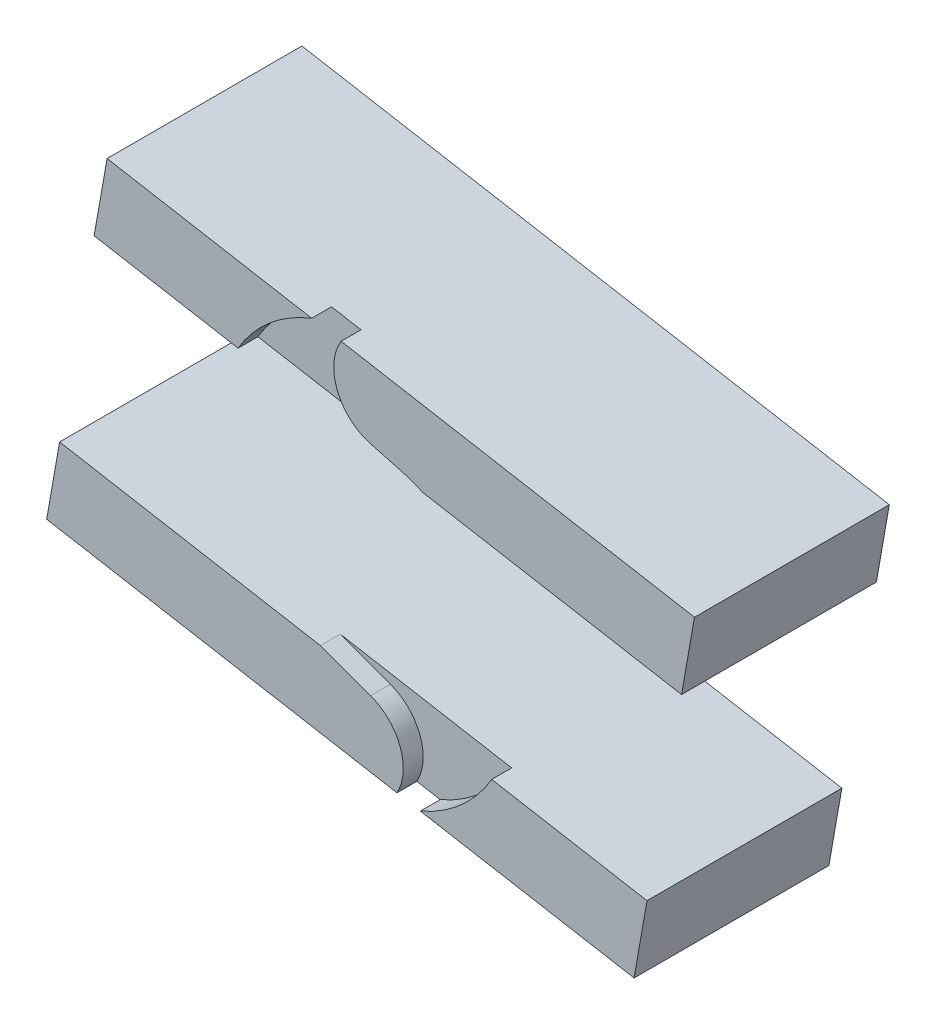
from build123d import *

# Parameters (mm, degrees)
BOSS_EXTRUDE1_DEPTH        = 3.048
BOSS_EXTRUDE2_DEPTH        = 2.032
BOSS_EXTRUDE2_DEPTH_BACK   = 47.752
BOSS_EXTRUDE2_2_DEPTH      = 2.032
BOSS_EXTRUDE2_2_DEPTH_BACK = 47.752
INTERSECT1_START           = -3.048
INTERSECT1_DEPTH           = 6.096


# Read off the part's stored shape, not the designer's step: Intersect1
with BuildPart() as part:
    # Sketch1 → Boss-Extrude1 (new, symmetric)
    with BuildSketch(Plane.XY):
        with BuildLine():
            ThreePointArc((0, 27.535484012), (-9.412998127, 39.802742006), (0, 52.07))
            Line((0, 52.07), (-11.040532194, 49.111698314))
            ThreePointArc((-11.040532194, 49.111698314), (-39.066320922, 14.192289272), (-14.190605813, -23.03684931))
            Line((-14.190605813, -23.03684931), (0, -28.201807432))
            ThreePointArc((0, -28.201807432), (8.35634418, -40.135903716), (0, -52.07))
            Line((0, -52.07), (10.740686656, -48.160709762))
            ThreePointArc((10.740686656, -48.160709762), (36.144496882, -10.141220984), (7.52373904, 25.519504212))
            Line((7.52373904, 25.519504212), (0, 27.535484012))
        make_face()
        with BuildLine():
            Line((-12.7, 7.332348419), (-1.374815329, 13.870946837))
            ThreePointArc((-1.374815329, 13.870946837), (-0.410875234, 16.198104087), (1.5875, 14.664696837))
            ThreePointArc((1.5875, 14.664696837), (1.533407249, 14.253821603), (1.374815329, 13.870946837))
            Line((1.374815329, 13.870946837), (12.7, 7.332348419))
            Line((12.7, 7.332348419), (12.7, -7.332348419))
            Line((12.7, -7.332348419), (0, -14.664696837))
            Line((0, -14.664696837), (-12.7, -7.332348419))
            Line((-12.7, -7.332348419), (-12.7, 7.332348419))
        make_face(mode=Mode.SUBTRACT)
    extrude(amount=BOSS_EXTRUDE1_DEPTH, both=True)


with BuildPart() as body_2:
    # Sketch2 → Boss-Extrude2 (new, two sides: drawn at the far end of the back side and taken through both)
    with BuildSketch(Plane.XY.offset(-BOSS_EXTRUDE2_DEPTH_BACK)):
        Polygon((-70.631687067, 38.246108065), (79.453014492, 11.782125788), (82.761012277, 30.542713483), (-67.323689282, 57.00669576), align=None)
    extrude(amount=BOSS_EXTRUDE2_DEPTH + BOSS_EXTRUDE2_DEPTH_BACK)


with BuildPart() as body_3:
    # Sketch2 → Boss-Extrude2 2 (new, two sides: drawn at the far end of the back side and taken through both)
    with BuildSketch(Plane.XY.offset(-BOSS_EXTRUDE2_2_DEPTH_BACK)):
        Polygon((-79.453014492, -11.782125788), (70.631687067, -38.246108065), (67.323689282, -57.00669576), (-82.761012277, -30.542713483), align=None)
    extrude(amount=BOSS_EXTRUDE2_2_DEPTH + BOSS_EXTRUDE2_2_DEPTH_BACK)


with BuildPart() as intersect1_tool:
    # Intersect1 outline → Intersect1 (new body)
    with BuildSketch(Plane.XY.offset(INTERSECT1_START)):
        with BuildLine():
            Line((0, 52.07), (-11.040532194, 49.111698314))
            ThreePointArc((-11.040532194, 49.111698314), (-39.066320922, 14.192289271), (-14.190605813, -23.03684931))
            Line((-14.190605813, -23.03684931), (0, -28.201807432))
            ThreePointArc((0, -28.201807432), (8.35634418, -40.135903716), (0, -52.07))
            Line((0, -52.07), (10.740686656, -48.160709762))
            ThreePointArc((10.740686656, -48.160709762), (36.144496882, -10.141220984), (7.52373904, 25.519504212))
            Line((7.52373904, 25.519504212), (0, 27.535484012))
            ThreePointArc((0, 27.535484012), (-9.412998127, 39.802742006), (0, 52.07))
        make_face()
        with BuildLine():
            Line((-12.7, 7.332348419), (-1.374815329, 13.870946837))
            ThreePointArc((-1.374815329, 13.870946837), (0, 16.252196837), (1.374815329, 13.870946837))
            Line((1.374815329, 13.870946837), (12.7, 7.332348419))
            Line((12.7, 7.332348419), (12.7, -7.332348419))
            Line((12.7, -7.332348419), (0, -14.664696837))
            Line((0, -14.664696837), (-12.7, -7.332348419))
            Line((-12.7, -7.332348419), (-12.7, 7.332348419))
        make_face(mode=Mode.SUBTRACT)
    extrude(amount=INTERSECT1_DEPTH)


with BuildPart() as part_1:
    add(part.part)

    # Intersect1: cut by intersect1_tool
    add(intersect1_tool.part, mode=Mode.SUBTRACT)


with BuildPart() as body_2_1:
    add(body_2.part)

    # Intersect1: cut by intersect1_tool
    add(intersect1_tool.part, mode=Mode.SUBTRACT)


with BuildPart() as body_3_1:
    add(body_3.part)

    # Intersect1: cut by intersect1_tool
    add(intersect1_tool.part, mode=Mode.SUBTRACT)


solid = Compound([body_2_1.part, body_3_1.part])
